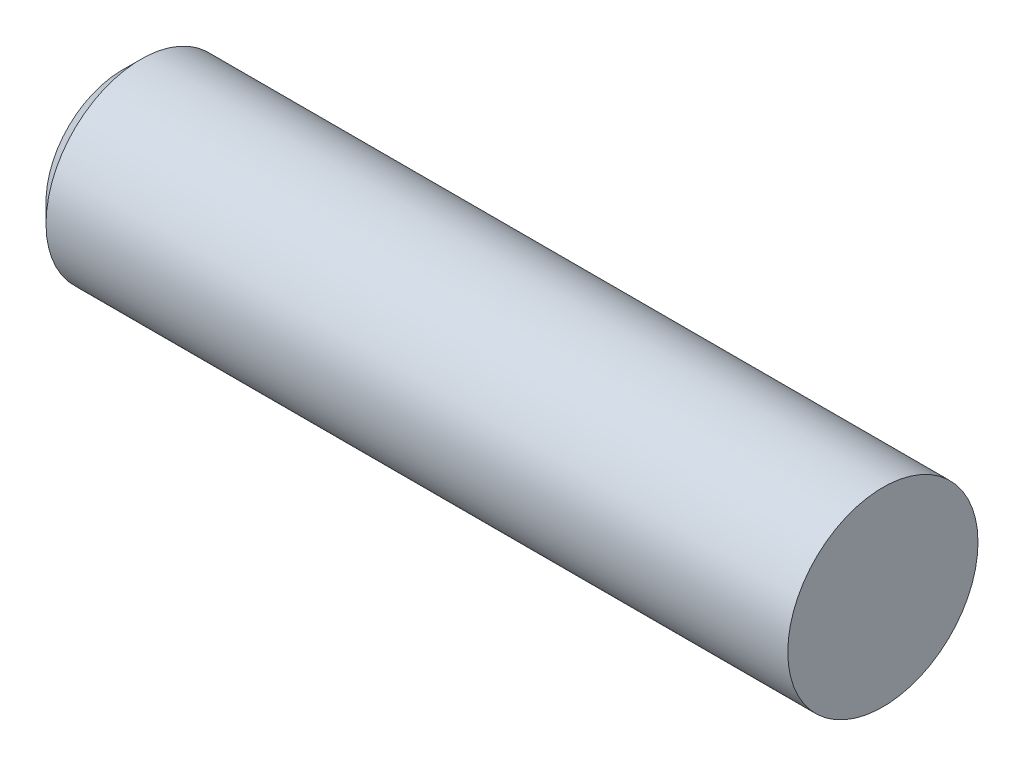
from build123d import *

# Parameters (mm, degrees)
EXTRUDE1_DEPTH        = 4.7625
EXTRUDE1_DEPTH_BACK   = 4.7625
SKETCH2_R             = 1.190625
CHAMFER1_SIZE         = 0.238125
DELETEFACE1_START     = 4.5243749
DELETEFACE1_OUTLINE_R = 1.190625
DELETEFACE1_DEPTH     = 0.2381251


# Read off the part's stored shape, not the designer's step: DeleteFace1
with BuildPart() as part:
    # Sketch2 → Extrude1 (new, two sides: drawn at the far end of the back side and taken through both)
    with BuildSketch(Plane(origin=(0, 0, 0), x_dir=(0, 0, -1), z_dir=(1, 0, 0)).offset(-EXTRUDE1_DEPTH_BACK)):
        Circle(SKETCH2_R)
    extrude(amount=EXTRUDE1_DEPTH + EXTRUDE1_DEPTH_BACK)

    # Chamfer1
    chamfer1_edges = [part.edges().sort_by_distance(p)[0] for p in [
        (-4.7625, 0, 1.190625),
        (4.7625, 0, 1.190625),
    ]]
    chamfer(chamfer1_edges, length=CHAMFER1_SIZE)

    # DeleteFace1 outline → DeleteFace1 (add)
    with BuildSketch(Plane.YZ.offset(DELETEFACE1_START)):
        Circle(DELETEFACE1_OUTLINE_R)
    extrude(amount=DELETEFACE1_DEPTH)


solid = part.part
